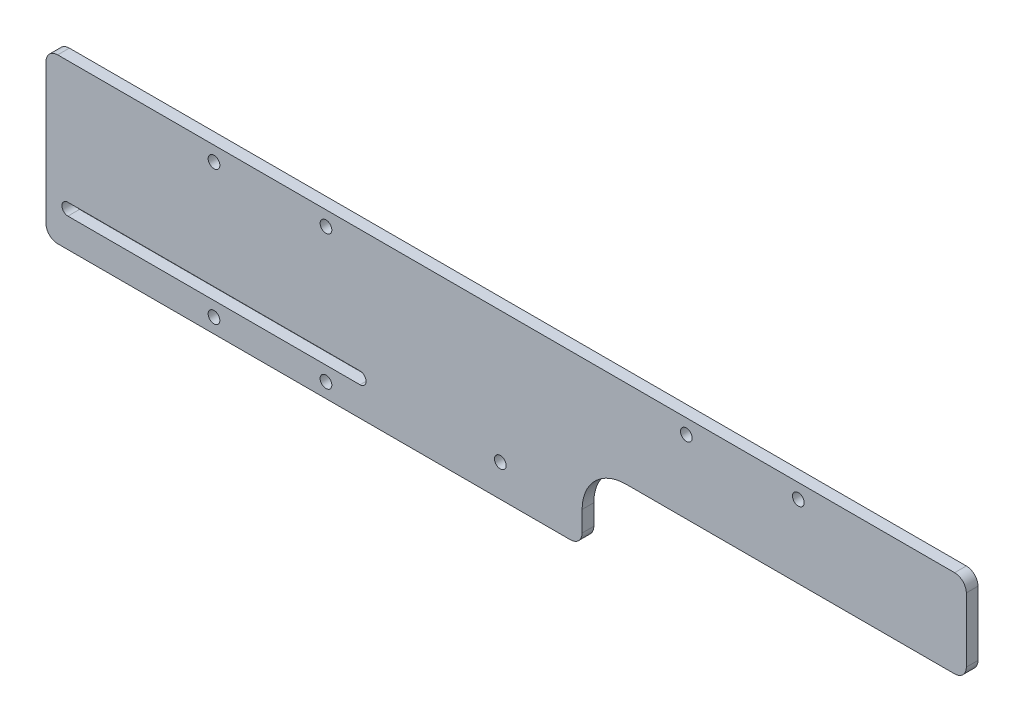
from build123d import *

# Parameters (mm, degrees)
SKETCH_1_R          = 2
EXTRUDE_1_DEPTH     = 4
CUT_EXTRUDE_1_DEPTH = 4
EXTRUDE_2_DEPTH     = 4
EXTRUDE_3_DEPTH     = 4
SKETCH_18_R         = 2
CUT_EXTRUDE_2_DEPTH = 161.019530058


with BuildPart() as part:
    # 草图1 → 凸台-拉伸1 (new body)
    with BuildSketch(Plane.XY):
        with BuildLine():
            Line((153.5, -28), (-153.5, -28))
            ThreePointArc((-153.5, -28), (-156.328427125, -26.828427125), (-157.5, -24))
            Line((-157.5, -24), (-157.5, 24))
            ThreePointArc((-157.5, 24), (-156.328427125, 26.828427125), (-153.5, 28))
            Line((-153.5, 28), (153.5, 28))
            ThreePointArc((153.5, 28), (156.328427125, 26.828427125), (157.5, 24))
            Line((157.5, 24), (157.5, -24))
            ThreePointArc((157.5, -24), (156.328427125, -26.828427125), (153.5, -28))
        make_face()
        with Locations((-100, 23)):
            Circle(SKETCH_1_R, mode=Mode.SUBTRACT)
        with Locations((-61.67, 23)):
            Circle(SKETCH_1_R, mode=Mode.SUBTRACT)
        with Locations((-100, -23)):
            Circle(SKETCH_1_R, mode=Mode.SUBTRACT)
        with Locations((-61.67, -23)):
            Circle(SKETCH_1_R, mode=Mode.SUBTRACT)
        with Locations((100, -23)):
            Circle(SKETCH_1_R, mode=Mode.SUBTRACT)
        with Locations((61.67, -23)):
            Circle(SKETCH_1_R, mode=Mode.SUBTRACT)
        with Locations((61.67, 23)):
            Circle(SKETCH_1_R, mode=Mode.SUBTRACT)
        with Locations((100, 23)):
            Circle(SKETCH_1_R, mode=Mode.SUBTRACT)
        with BuildLine():
            Line((-150, -13.95), (-50, -13.95))
            ThreePointArc((-50, -13.95), (-47.95, -16), (-50, -18.05))
            Line((-50, -18.05), (-150, -18.05))
            ThreePointArc((-150, -18.05), (-152.05, -16), (-150, -13.95))
        make_face(mode=Mode.SUBTRACT)
    extrude(amount=EXTRUDE_1_DEPTH)

    # 草图2 → 切除-拉伸1 (cut)
    with BuildSketch(Plane.XY.offset(4)):
        with BuildLine():
            Line((0, -12), (0, -24))
            ThreePointArc((0, -24), (-1.171572875, -26.828427125), (-4, -28))
            Line((-4, -28), (157.5, -28))
            Line((157.5, -28), (157.5, 2))
            ThreePointArc((157.5, 2), (156.328427125, -0.828427125), (153.5, -2))
            Line((153.5, -2), (10, -2))
            ThreePointArc((10, -2), (2.928932188, -4.928932188), (0, -12))
        make_face()
    extrude(amount=-CUT_EXTRUDE_1_DEPTH, mode=Mode.SUBTRACT)

    # 草图3 → 凸台-拉伸2 (add)
    with BuildSketch(Plane.XY.offset(4)):
        with BuildLine():
            Line((26, -24), (26, 24))
            ThreePointArc((26, 24), (27.171572875, 26.828427125), (30, 28))
            Line((30, 28), (-4, 28))
            Line((-4, 28), (-4, -28))
            Line((-4, -28), (22, -28))
            ThreePointArc((22, -28), (24.828427125, -26.828427125), (26, -24))
        make_face()
    extrude(amount=-EXTRUDE_2_DEPTH)

    # 草图17 → 凸台-拉伸3 (add)
    with BuildSketch(Plane.XY.offset(4)):
        with BuildLine():
            Line((26, -2), (26, -8.742458912))
            Line((26, -8.742458912), (26, -17))
            ThreePointArc((26, -17), (30.393398282, -6.393398282), (41, -2))
            Line((41, -2), (26, -2))
        make_face()
    extrude(amount=-EXTRUDE_3_DEPTH)

    # 草图18 → 切除-拉伸2 (cut, through all)
    with BuildSketch(Plane.XY.offset(4)):
        with Locations((-2, -17)):
            Circle(SKETCH_18_R)
    extrude(amount=-CUT_EXTRUDE_2_DEPTH, mode=Mode.SUBTRACT)


solid = part.part
